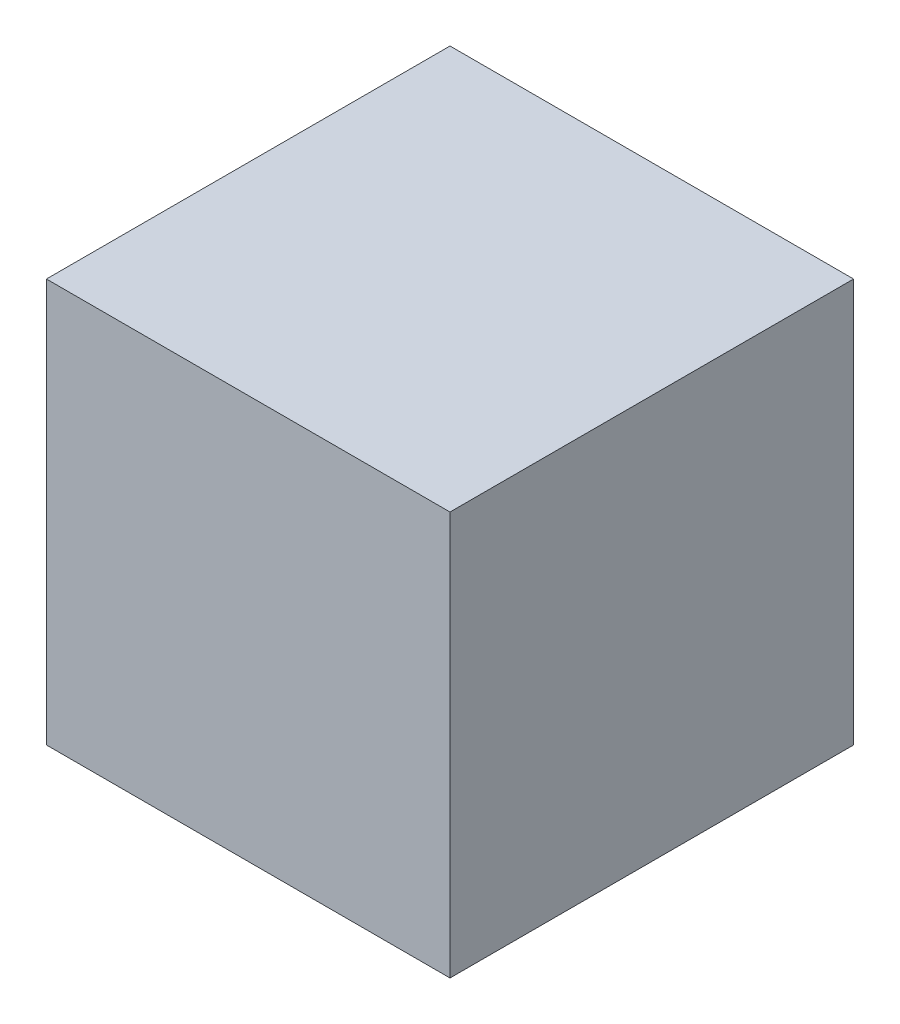
from build123d import *

# Parameters (mm, degrees)
SKETCH1_W           = 1
SKETCH1_H           = 1
BOSS_EXTRUDE1_DEPTH = 1


with BuildPart() as part:
    # Sketch1 → Boss-Extrude1 (new body)
    with BuildSketch(Plane.XY):
        Rectangle(SKETCH1_W, SKETCH1_H)
    extrude(amount=BOSS_EXTRUDE1_DEPTH)


solid = part.part
